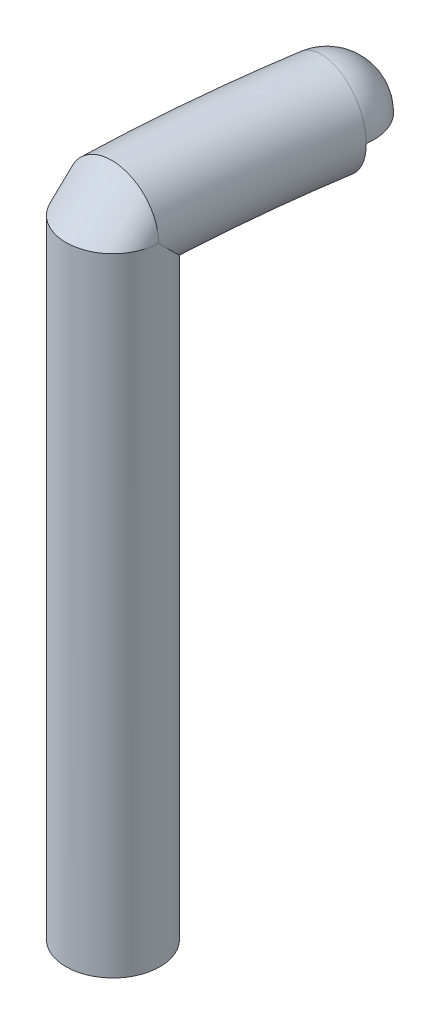
from build123d import *

# Parameters (mm, degrees)
SKETCH1_R           = 1.5
BOSS_EXTRUDE1_DEPTH = 10
SWEEP1_PROFILE_R    = 1.5
REVOLVE1_ANGLE      = 90


with BuildPart() as part:
    # Sketch1 → Boss-Extrude1 (new, symmetric)
    with BuildSketch(Plane(origin=(0, 0, 0), x_dir=(1, 0, 0), z_dir=(0, 1, 0))):
        with Locations(Location((0, 0, 0), (0, 0, 270))):
            Circle(SKETCH1_R)
    extrude(amount=BOSS_EXTRUDE1_DEPTH, both=True)

    # Sweep1: sweep along a path in Sketch2
    with BuildLine(Plane(origin=(0, 10, 0), x_dir=(1, 0, 0), z_dir=(0, 1, 0))) as sweep1_path:
        ThreePointArc((0, 0), (0.188851733, 3.135225091), (0.574182733, 6.252406729))
    # Sweep1 profile (on start of the path) → Sweep1 (sweep)
    with BuildSketch(Plane(origin=(0, 10, 0), x_dir=(-0.9995867895951688, 0, -0.028744565865985165), z_dir=(0.028744565865985165, 0, -0.9995867895951688))):
        Circle(SWEEP1_PROFILE_R)
    sweep(path=sweep1_path.line)

    # Loft1: read off the stored shape, not the designer's step
    # Loft1: loft between two sections, ruled curve by curve
    loft1_from = [
        Edge.make_bspline([(-1.499380184, 10, -0.043116849), (-1.502973255, 10, 0.0818315), (-1.491844018, 10, 0.223609989), (-1.411111372, 10, 0.533258564), (-1.340725541, 10, 0.701751397), (-1.110022973, 10, 1.028517866), (-0.947978833, 10, 1.186043614), (-0.539291074, 10, 1.419340854), (-0.293013546, 10, 1.492194043), (0.206779849, 10, 1.506566326), (0.456836938, 10, 1.447985958), (0.878255855, 10, 1.238559637), (1.049084493, 10, 1.090606128), (1.298183584, 10, 0.777637051), (1.378135606, 10, 0.613467401), (1.476528913, 10, 0.308969852), (1.495787114, 10, 0.168065197), (1.499380184, 10, 0.043116849)], [0, 0, 0, 0, 0.125, 0.125, 0.25, 0.25, 0.375, 0.375, 0.5, 0.5, 0.625, 0.625, 0.75, 0.75, 0.875, 0.875, 1, 1, 1, 1], 3),
        Edge.make_line((1.499380184, 10, 0.043116849), (-1.499380184, 10, -0.043116849)),
    ]
    loft1_to = [
        Edge.make_bspline([(-1.499380184, 10, -0.043116849), (-1.499380184, 10.125, -0.043116849), (-1.484186465, 10.2664, -0.042679931), (-1.394623489, 10.5736, -0.040104418), (-1.319454562, 10.74, -0.037942827), (-1.079553733, 11.06, -0.031044131), (-0.913117344, 11.212802768, -0.026258012), (-0.498064006, 11.434256055, -0.014322552), (-0.249896697, 11.5, -0.007186141), (0.249896697, 11.5, 0.007186141), (0.498064006, 11.434256055, 0.014322552), (0.913117344, 11.212802768, 0.026258012), (1.079553733, 11.06, 0.031044131), (1.319454562, 10.74, 0.037942827), (1.394623489, 10.5736, 0.040104418), (1.484186465, 10.2664, 0.042679931), (1.499380184, 10.125, 0.043116849), (1.499380184, 10, 0.043116849)], [0, 0, 0, 0, 0.125, 0.125, 0.25, 0.25, 0.375, 0.375, 0.5, 0.5, 0.625, 0.625, 0.75, 0.75, 0.875, 0.875, 1, 1, 1, 1], 3),
        Edge.make_line((1.499380184, 10, 0.043116849), (-1.499380184, 10, -0.043116849)),
    ]
    loft1 = Solid(Shell([*[Face.make_surface_from_curves(loft1_from[k], loft1_to[k]) for k in range(2)], Face(Wire(loft1_from)), Face(Wire(loft1_to))]))
    add(loft1)

    # Sketch9 → Revolve1 (revolve)
    with BuildSketch(Plane(origin=(0, 10, 0), x_dir=(-1, 0, 0), z_dir=(0, -1, 0))):
        with BuildLine():
            Line((-2.056337435, 6.021717679), (0.90797197, 6.48309578))
            ThreePointArc((0.90797197, 6.48309578), (-0.804871783, 7.734561432), (-2.056337435, 6.021717679))
        make_face()
    revolve(axis=Axis((2.056337435, 10, -6.021717679), (0.9881031349451361, 0, 0.15379270044964483)), revolution_arc=REVOLVE1_ANGLE)


solid = part.part
